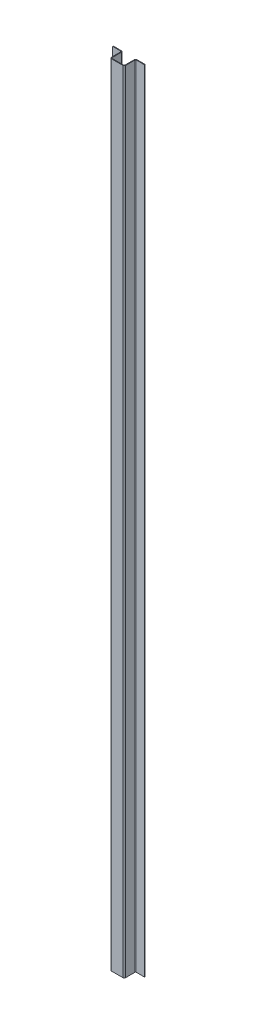
from build123d import *

# Parameters (mm, degrees)
SKETCH1_W                      = 45
SKETCH1_H                      = 2508
BASE_FLANGE1_DEPTH             = 2
EDGE_FLANGE1_STRIP_W           = 13
EDGE_FLANGE1_STRIP_H           = 2
EDGE_FLANGE1_STRIP_CUT_DEPTH   = 2508
EDGE_FLANGE1_STRIP_2_W         = 13
EDGE_FLANGE1_STRIP_2_H         = 2
EDGE_FLANGE1_STRIP_CUT_2_DEPTH = 2508
EDGE_FLANGE1_DEPTH             = 2508
EDGE_FLANGE1_BEND_DEPTH        = 2508
EDGE_FLANGE2_STRIP_W           = 13
EDGE_FLANGE2_STRIP_H           = 2
EDGE_FLANGE2_STRIP_CUT_DEPTH   = 2508
EDGE_FLANGE2_STRIP_2_W         = 13
EDGE_FLANGE2_STRIP_2_H         = 2
EDGE_FLANGE2_STRIP_CUT_2_DEPTH = 2508
EDGE_FLANGE2_DEPTH             = 2508
EDGE_FLANGE2_BEND_DEPTH        = 2508


# Sheet-metal steps are written as plain solids
with BuildPart() as part:
    # Sketch1 → Base-Flange1 (new body)
    with BuildSketch(Plane.XY):
        Rectangle(SKETCH1_W, SKETCH1_H)
    extrude(amount=-BASE_FLANGE1_DEPTH)

    # Edge-Flange1 strip (across the edge) → Edge-Flange1 strip cut (cut)
    with BuildSketch(Plane(origin=(22.5, 1254, -2), x_dir=(-1, 0, 0), z_dir=(0, -1, 0))):
        with Locations((-2, -1)):
            Rectangle(EDGE_FLANGE1_STRIP_W, EDGE_FLANGE1_STRIP_H)
    extrude(amount=EDGE_FLANGE1_STRIP_CUT_DEPTH, mode=Mode.SUBTRACT)

    # Edge-Flange1 strip 2 (across the edge) → Edge-Flange1 strip cut 2 (cut)
    with BuildSketch(Plane(origin=(-22.5, -1254, -2), x_dir=(1, 0, 0), z_dir=(0, 1, 0))):
        with Locations((-2, -1)):
            Rectangle(EDGE_FLANGE1_STRIP_2_W, EDGE_FLANGE1_STRIP_2_H)
    extrude(amount=EDGE_FLANGE1_STRIP_CUT_2_DEPTH, mode=Mode.SUBTRACT)

    # Edge-Flange1 section (across the edge) → Edge-Flange1 (add)
    with BuildSketch(Plane(origin=(22.5, 1254, -2), x_dir=(-1, 0, 0), z_dir=(0, -1, 0))):
        with BuildLine():
            Line((0, 2.5), (0, 36))
            Line((0, 36), (2, 36))
            Line((2, 36), (2, 2.5))
            ThreePointArc((2, 2.5), (2.732233047, 0.732233047), (4.5, 0))
            Line((4.5, 0), (4.5, -2))
            ThreePointArc((4.5, -2), (1.318019485, -0.681980515), (0, 2.5))
        make_face()
    extrude(amount=EDGE_FLANGE1_DEPTH)

    # Edge-Flange1 section 2 (across the edge) → Edge-Flange1 bend (add)
    with BuildSketch(Plane(origin=(-22.5, -1254, -2), x_dir=(1, 0, 0), z_dir=(0, 1, 0))):
        with BuildLine():
            Line((0, 2.5), (0, 36))
            Line((0, 36), (2, 36))
            Line((2, 36), (2, 2.5))
            ThreePointArc((2, 2.5), (2.732233047, 0.732233047), (4.5, 0))
            Line((4.5, 0), (4.5, -2))
            ThreePointArc((4.5, -2), (1.318019485, -0.681980515), (0, 2.5))
        make_face()
    extrude(amount=EDGE_FLANGE1_BEND_DEPTH)

    # Edge-Flange2 strip (across the edge) → Edge-Flange2 strip cut (cut)
    with BuildSketch(Plane(origin=(-22.5, 1254, -38), x_dir=(0, 0, 1), z_dir=(0, -1, 0))):
        with Locations((-2, -1)):
            Rectangle(EDGE_FLANGE2_STRIP_W, EDGE_FLANGE2_STRIP_H)
    extrude(amount=EDGE_FLANGE2_STRIP_CUT_DEPTH, mode=Mode.SUBTRACT)

    # Edge-Flange2 strip 2 (across the edge) → Edge-Flange2 strip cut 2 (cut)
    with BuildSketch(Plane(origin=(22.5, -1254, -38), x_dir=(0, 0, 1), z_dir=(0, 1, 0))):
        with Locations((-2, -1)):
            Rectangle(EDGE_FLANGE2_STRIP_2_W, EDGE_FLANGE2_STRIP_2_H)
    extrude(amount=EDGE_FLANGE2_STRIP_CUT_2_DEPTH, mode=Mode.SUBTRACT)

    # Edge-Flange2 section (across the edge) → Edge-Flange2 (add)
    with BuildSketch(Plane(origin=(-22.5, 1254, -38), x_dir=(0, 0, 1), z_dir=(0, -1, 0))):
        with BuildLine():
            Line((0, 2.5), (0, 28))
            Line((0, 28), (2, 28))
            Line((2, 28), (2, 2.5))
            ThreePointArc((2, 2.5), (2.732233047, 0.732233047), (4.5, 0))
            Line((4.5, 0), (4.5, -2))
            ThreePointArc((4.5, -2), (1.318019485, -0.681980515), (0, 2.5))
        make_face()
    extrude(amount=EDGE_FLANGE2_DEPTH)

    # Edge-Flange2 section 2 (across the edge) → Edge-Flange2 bend (add)
    with BuildSketch(Plane(origin=(22.5, -1254, -38), x_dir=(0, 0, 1), z_dir=(0, 1, 0))):
        with BuildLine():
            Line((0, 2.5), (0, 28))
            Line((0, 28), (2, 28))
            Line((2, 28), (2, 2.5))
            ThreePointArc((2, 2.5), (2.732233047, 0.732233047), (4.5, 0))
            Line((4.5, 0), (4.5, -2))
            ThreePointArc((4.5, -2), (1.318019485, -0.681980515), (0, 2.5))
        make_face()
    extrude(amount=EDGE_FLANGE2_BEND_DEPTH)


solid = part.part
